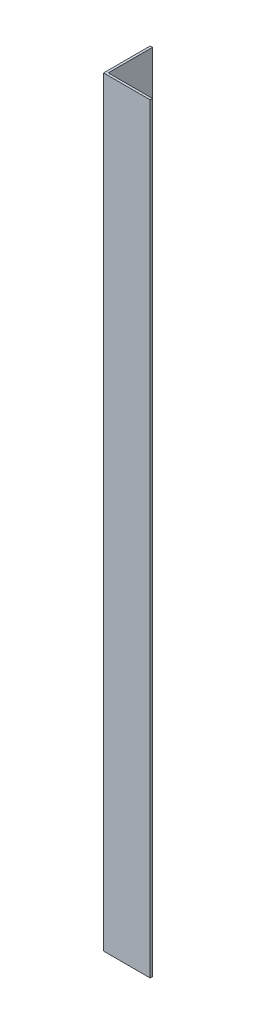
from build123d import *

# Parameters (mm, degrees)
EXTRUDE_1_DEPTH = 245


with BuildPart() as part:
    # Эскиз1 → Бобышка-Вытянуть1 (new body)
    with BuildSketch(Plane(origin=(0, 0, 0), x_dir=(1, 0, 0), z_dir=(0, 1, 0))):
        Polygon((0, 0), (0, 15), (0.75, 15), (0.75, 0.75), (15, 0.75), (15, 0), align=None)
    extrude(amount=EXTRUDE_1_DEPTH)


solid = part.part
